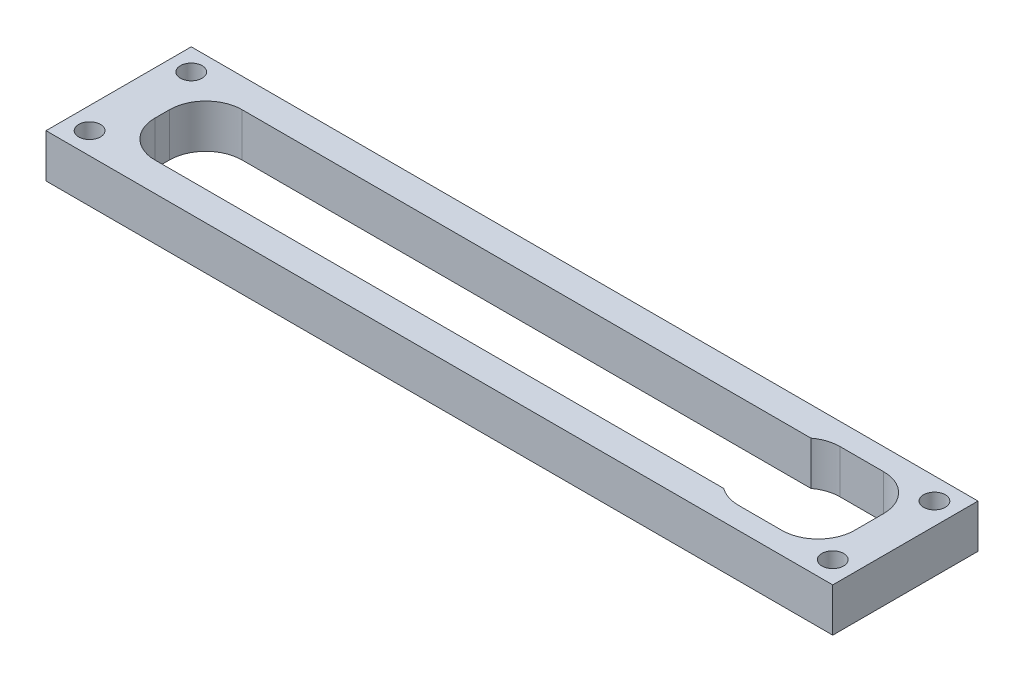
from build123d import *

# Parameters (mm, degrees)
SKETCH1_W           = 108.320866354
SKETCH1_H           = 20
SKETCH1_R           = 1.5
SKETCH1_W_2         = 96.320866354
SKETCH1_H_2         = 12
BOSS_EXTRUDE1_DEPTH = 6
CUT_EXTRUDE1_DEPTH  = 111.315049234
FILLET1_R           = 5


with BuildPart() as part:
    # Sketch1 → Boss-Extrude1 (new body)
    with BuildSketch(Plane(origin=(0, 0, 0), x_dir=(1, 0, 0), z_dir=(0, 1, 0))):
        with Locations((54.160433177, 10)):
            Rectangle(SKETCH1_W, SKETCH1_H)
        with Locations(Location((3, 17, 0), (0, 0, 270))):
            Circle(SKETCH1_R, mode=Mode.SUBTRACT)
        with Locations(Location((3, 3, 0), (0, 0, 90))):
            Circle(SKETCH1_R, mode=Mode.SUBTRACT)
        with Locations(Location((105.320866354, 3, 0), (0, 0, 270))):
            Circle(SKETCH1_R, mode=Mode.SUBTRACT)
        with Locations(Location((105.320866354, 17, 0), (0, 0, 90))):
            Circle(SKETCH1_R, mode=Mode.SUBTRACT)
        with Locations((54.160433177, 10)):
            Rectangle(SKETCH1_W_2, SKETCH1_H_2, mode=Mode.SUBTRACT)
    extrude(amount=BOSS_EXTRUDE1_DEPTH)

    # Sketch2 → Cut-Extrude1 (cut, through all)
    with BuildSketch(Plane(origin=(0, 6, 0), x_dir=(1, 0, 0), z_dir=(0, 1, 0))):
        Polygon((89.320866354, 17), (89.320866354, 16), (102.320866354, 16), (102.320866354, 4), (89.320866354, 4), (89.320866354, 3), (103.320866354, 3), (103.320866354, 17), align=None)
    extrude(amount=-CUT_EXTRUDE1_DEPTH, mode=Mode.SUBTRACT)

    # Fillet1
    # the kernel refuses this fillet: 5 mm, written as the material it adds along each edge
    with BuildSketch(Plane(origin=(103.320866354, 6, -17), x_dir=(0, 0, 1), z_dir=(0, -1, 0)), Plane(origin=(103.320866354, 6, -3), x_dir=(-1, 0, 0), z_dir=(0, -1, 0)), Plane(origin=(6, 0, -16), x_dir=(0, 0, 1), z_dir=(0, 1, 0))) as fillet1_piece_1:
        with BuildLine():
            CenterArc((FILLET1_R, FILLET1_R), FILLET1_R, 180, 90)
            Line((0, FILLET1_R), (-FILLET1_R * 0.02, FILLET1_R))
            Line((-FILLET1_R * 0.02, FILLET1_R), (-FILLET1_R * 0.02, -FILLET1_R * 0.02))
            Line((-FILLET1_R * 0.02, -FILLET1_R * 0.02), (FILLET1_R, -FILLET1_R * 0.02))
            Line((FILLET1_R, -FILLET1_R * 0.02), (FILLET1_R, 0))
        make_face()
    extrude(amount=6)
    with BuildSketch(Plane(origin=(89.320866354, 6, -17), x_dir=(1, 0, 0), z_dir=(0, -1, 0))) as fillet1_piece_2:
        with BuildLine():
            CenterArc((3, 5), FILLET1_R, 233.130102354, 36.869897646)
            Line((0, 1), (-0.06, 0.92))
            ThreePointArc((-0.06, 0.92), (-0.1, 0.5), (-0.1, 0))
            Line((-0.1, 0), (0, -0.1))
            Line((0, -0.1), (3, -0.1))
            Line((3, -0.1), (3, 0))
        make_face()
    extrude(amount=6)
    with BuildSketch(Plane(origin=(89.320866354, 6, -3), x_dir=(0, 0, -1), z_dir=(0, -1, 0))) as fillet1_piece_3:
        with BuildLine():
            CenterArc((5, 3), FILLET1_R, 180, 36.869897646)
            Line((0, 3), (-0.1, 3))
            Line((-0.1, 3), (-0.1, 0))
            Line((-0.1, 0), (0, -0.1))
            ThreePointArc((0, -0.1), (0.5, -0.1), (0.92, -0.06))
            Line((0.92, -0.06), (1, 0))
        make_face()
    extrude(amount=6)
    with BuildSketch(Plane(origin=(6, 0, -4), x_dir=(0, 0, -1), z_dir=(0, 1, 0))) as fillet1_piece_4:
        with BuildLine():
            CenterArc((FILLET1_R, -FILLET1_R), FILLET1_R, 90, 90)
            Line((0, -FILLET1_R), (-FILLET1_R * 0.02, -FILLET1_R))
            Line((-FILLET1_R * 0.02, -FILLET1_R), (-FILLET1_R * 0.02, FILLET1_R * 0.02))
            Line((-FILLET1_R * 0.02, FILLET1_R * 0.02), (FILLET1_R, FILLET1_R * 0.02))
            Line((FILLET1_R, FILLET1_R * 0.02), (FILLET1_R, 0))
        make_face()
    extrude(amount=6)


solid = part.part
